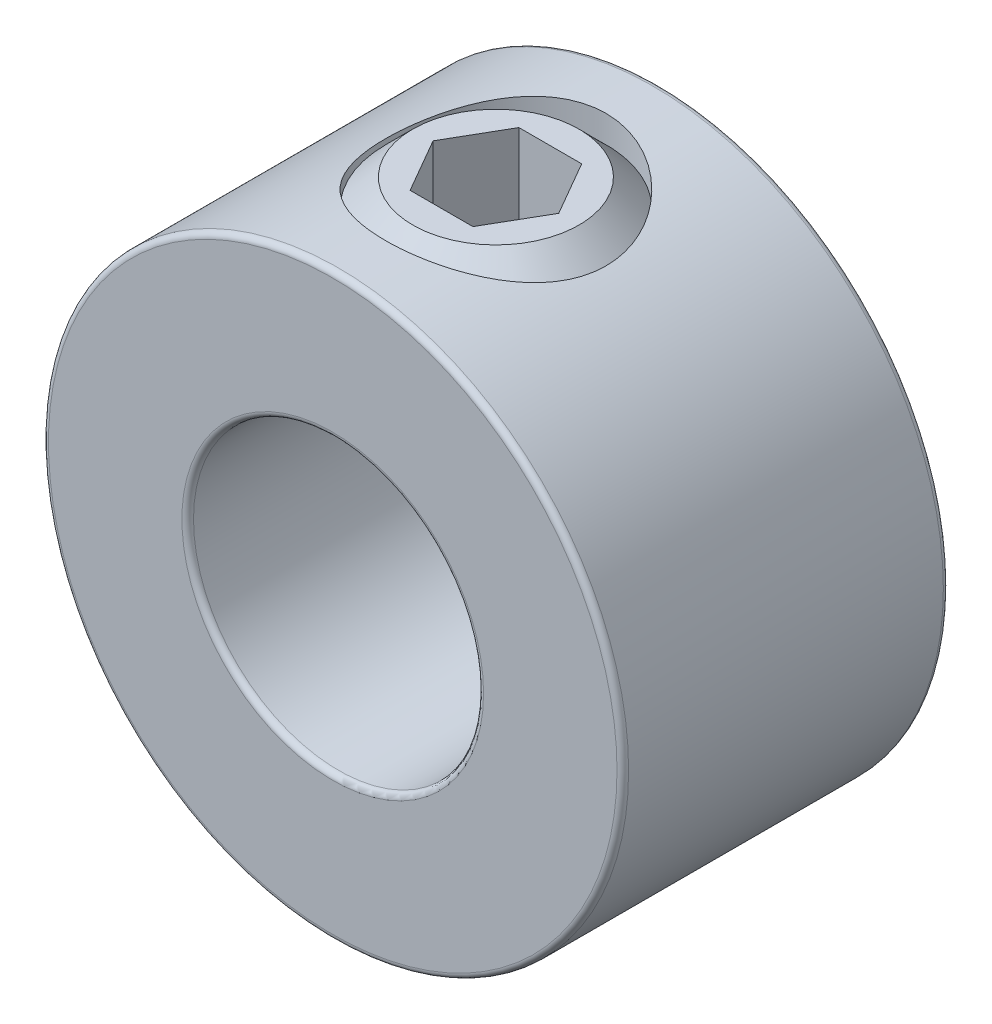
from build123d import *

# Parameters (mm, degrees)
SKETCH1_R          = 6.35
SKETCH1_R_2        = 3.175
EXTRUDE1_DEPTH     = 3.571875
SKETCH2_R          = 2.413
CUT_EXTRUDE1_DEPTH = 49.179055782
FILLET1_R          = 0.127
CUT_EXTRUDE2_DEPTH = 2.38125


with BuildPart() as part:
    # Sketch1 → Extrude1 (new, symmetric)
    with BuildSketch(Plane.XY):
        Circle(SKETCH1_R)
        Circle(SKETCH1_R_2, mode=Mode.SUBTRACT)
    extrude(amount=EXTRUDE1_DEPTH, both=True)

    # Sketch2 → Cut-Extrude1 (cut, through all)
    with BuildSketch(Plane(origin=(41.275, 0, 0), x_dir=(0, 0, -1), z_dir=(0, -1, 0))):
        with Locations((0, -41.275)):
            Circle(SKETCH2_R)
    extrude(amount=-CUT_EXTRUDE1_DEPTH, mode=Mode.SUBTRACT)

    # Fillet1
    fillet1_edges = [part.edges().sort_by_distance(p)[0] for p in [
        (-3.175, 0, -3.571875),
        (-3.175, 0, 3.571875),
        (-6.35, 0, -3.571875),
        (-6.35, 0, 3.571875),
    ]]
    fillet(fillet1_edges, radius=FILLET1_R)


with BuildPart() as body_2:
    # Sketch3 → Revolve1 (revolve)
    with BuildSketch(Plane.XY):
        Polygon((-1.819751616, 3.175), (-0.71189806, 3.175), (0, 3.88689806), (0, 6.35), (-1.819751616, 6.35), (-2.413, 5.756751616), (-2.413, 3.768248384), align=None)
    revolve(axis=Axis((0, 3.175, 0), (0, -1, 0)))

    # Sketch4 → Cut-Extrude2 (cut)
    with BuildSketch(Plane(origin=(3.3734375, 6.35, 0), x_dir=(0, 0, -1), z_dir=(0, -1, 0))):
        Polygon((0, -1.998622171), (-1.190625, -2.686029836), (-1.190625, -4.060845164), (0, -4.748252829), (1.190625, -4.060845164), (1.190625, -2.686029836), align=None)
    extrude(amount=CUT_EXTRUDE2_DEPTH, mode=Mode.SUBTRACT)


solid = Compound([part.part, body_2.part])
